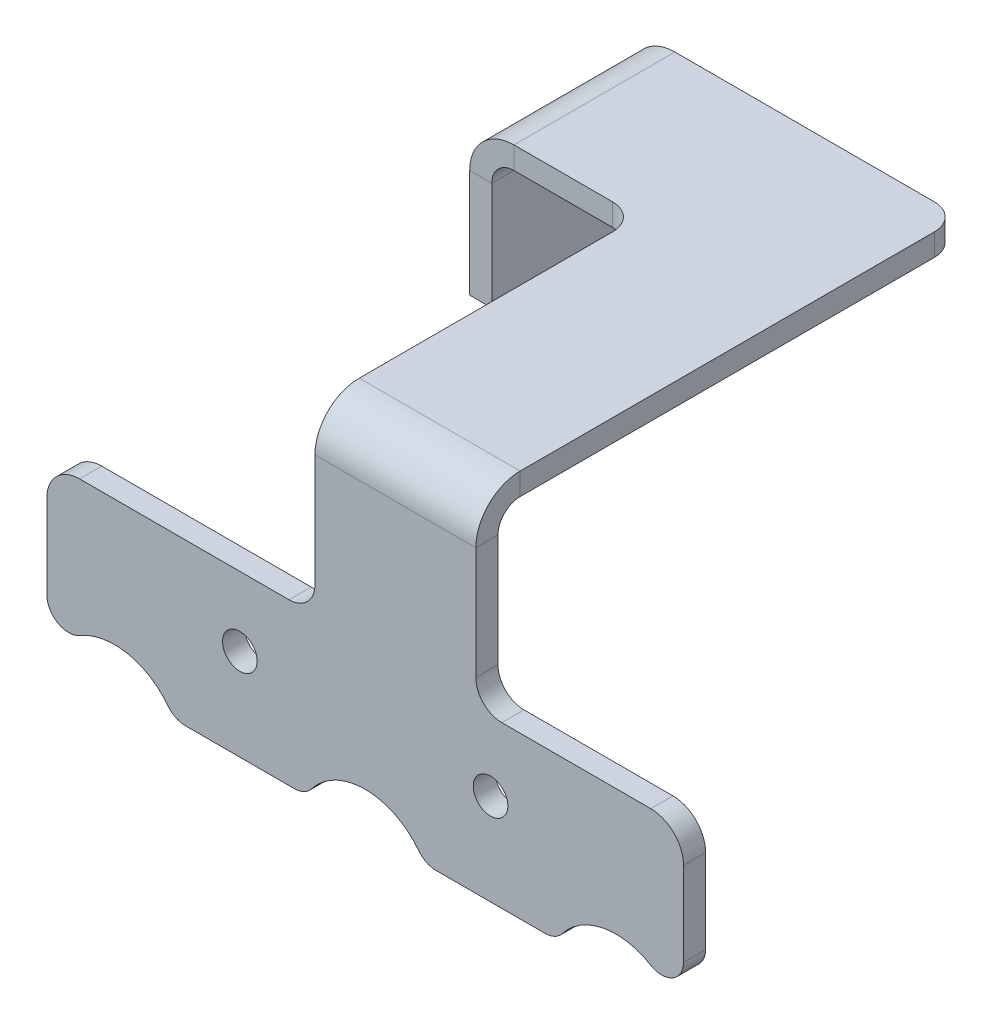
from build123d import *

# Parameters (mm, degrees)
BOSS_EXTRUDE1_DEPTH = 2.032
FILLET1_R           = 3
FILLET2_R           = 2
SKETCH14_R          = 1.5874999999999986
CUT_EXTRUDE1_DEPTH  = 70.16809880796494
SKETCH15_W          = 14.760000000000002
SKETCH15_H          = 12.699999999999996
BOSS_EXTRUDE4_DEPTH = 2.032
EDGE_FLANGE3_DEPTH  = 14.760000000000002
BOSS_EXTRUDE5_DEPTH = 2.032
EDGE_FLANGE4_DEPTH  = 14.760000000000002
FILLET4_R           = 2.38125


# Sheet-metal steps are written as plain solids
with BuildPart() as part:
    # Sketch3 → Boss-Extrude1 (new body)
    with BuildSketch(Plane.XY):
        with BuildLine():
            ThreePointArc((4.574999999999999, 10.775), (9.225864227432316, 16.77834726283189), (16.200863986500366, 13.774999999999732))
            Line((16.20086398650046, 13.774999999999999), (28.34913601349985, 13.774999999999999))
            ThreePointArc((28.349136013499827, 13.775000000000073), (33.77500000000019, 16.974999999999998), (39.20086398650036, 13.77499999999973))
            Line((39.20086398650045, 13.774999999999999), (51.34913601349986, 13.774999999999999))
            ThreePointArc((51.34913601349983, 13.775000000000077), (58.32413577256787, 16.778347262831836), (62.974999999999994, 10.775000000000002))
            Line((62.974999999999994, 10.775), (62.975, 28.534999999999997))
            Line((62.97500000000001, 28.534999999999997), (4.574999999999999, 28.534999999999997))
            Line((4.574999999999999, 28.534999999999997), (4.574999999999999, 10.774999999999999))
        make_face()
    extrude(amount=BOSS_EXTRUDE1_DEPTH)

    # Fillet1
    fillet1_edges = [part.edges().sort_by_distance(p)[0] for p in [
        (4.574999999999999, 28.534999999999997, 1.016),
        (62.97500000000001, 28.534999999999997, 1.016),
    ]]
    fillet(fillet1_edges, radius=FILLET1_R)

    # Fillet2
    fillet2_edges = [part.edges().sort_by_distance(p)[0] for p in [
        (62.974999999999994, 10.775000000000002, 1.016),
    ]]
    fillet(fillet2_edges, radius=FILLET2_R)
    fillet2_2_edges = [part.edges().sort_by_distance(p)[0] for p in [
        (51.349136013499844, 13.775000000000038, 1.016),
    ]]
    fillet(fillet2_2_edges, radius=FILLET2_R)
    fillet2_3_edges = [part.edges().sort_by_distance(p)[0] for p in [
        (39.20086398650041, 13.774999999999864, 1.016),
    ]]
    fillet(fillet2_3_edges, radius=FILLET2_R)
    fillet2_4_edges = [part.edges().sort_by_distance(p)[0] for p in [
        (28.349136013499837, 13.775000000000036, 1.016),
    ]]
    fillet(fillet2_4_edges, radius=FILLET2_R)
    fillet2_5_edges = [part.edges().sort_by_distance(p)[0] for p in [
        (4.574999999999999, 10.774999999999999, 1.016),
    ]]
    fillet(fillet2_5_edges, radius=FILLET2_R)
    fillet2_6_edges = [part.edges().sort_by_distance(p)[0] for p in [
        (16.200863986500412, 13.774999999999865, 1.016),
    ]]
    fillet(fillet2_6_edges, radius=FILLET2_R)

    # Sketch14 → Cut-Extrude1 (cut, through all)
    with BuildSketch(Plane(origin=(0, 0, 0), x_dir=(-1, 0, 0), z_dir=(0, 0, -1))):
        with Locations((-45.275, 22.184999999999995)):
            Circle(SKETCH14_R)
        with Locations((-22.275000000000002, 22.184999999999995)):
            Circle(SKETCH14_R)
    extrude(amount=-CUT_EXTRUDE1_DEPTH, mode=Mode.SUBTRACT)

    # Sketch15 → Boss-Extrude4 (add)
    with BuildSketch(Plane.XY.offset(2.032)):
        with Locations((36.545, 34.88499999999999)):
            Rectangle(SKETCH15_W, SKETCH15_H)
    extrude(amount=-BOSS_EXTRUDE4_DEPTH)

    # Edge-Flange3 section (across the edge) → Edge-Flange3 (add)
    with BuildSketch(Plane(origin=(29.165000000000003, 43.266999999999996, 1.419e-14), x_dir=(0, -1, -3.49e-15), z_dir=(1, 0, 0))):
        with BuildLine():
            Line((-2.032, 2.032000000000007), (-2.032, 42.418000000000006))
            Line((-2.032, 42.418000000000006), (0, 42.418000000000006))
            Line((0, 42.418000000000006), (0, 2.032000000000007))
            ThreePointArc((0, 2.032000000000007), (0.5951590206289381, 0.5951590206289399), (2.032000000000007, 7.11e-15))
            Line((2.032000000000007, 7.11e-15), (2.0320000000000142, -2.031999999999993))
            ThreePointArc((2.0320000000000142, -2.031999999999993), (-0.8416819587421238, -0.8416819587421274), (-2.032, 2.032000000000007))
        make_face()
    extrude(amount=EDGE_FLANGE3_DEPTH)

    # Sketch19 → Boss-Extrude5 (add)
    with BuildSketch(Plane(origin=(0, 45.298999999999985, 1.5561e-13), x_dir=(1, 0, 0), z_dir=(0, 1, 3.44e-15))):
        Polygon((29.165000000000003, 42.41800000000015), (17.735000000000003, 42.41800000000015), (17.73500000000001, 27.658000000000147), (29.165000000000006, 27.658000000000147), align=None)
    extrude(amount=-BOSS_EXTRUDE5_DEPTH)

    # Edge-Flange4 section (across the edge) → Edge-Flange4 (add)
    with BuildSketch(Plane(origin=(15.703000000000005, 43.2670000000001, -27.657999999999998), x_dir=(1, -3.49e-15, -4.7e-16), z_dir=(-4.7e-16, 3.29e-15, -1))):
        with BuildLine():
            Line((-2.032, 2.032000000000007), (-2.032, 11.93800000000001))
            Line((-2.032, 11.93800000000001), (0, 11.93800000000001))
            Line((0, 11.93800000000001), (0, 2.032000000000007))
            ThreePointArc((0, 2.032000000000007), (0.5951590206289381, 0.5951590206289399), (2.032000000000007, 7.11e-15))
            Line((2.032000000000007, 7.11e-15), (2.0320000000000142, -2.031999999999993))
            ThreePointArc((2.0320000000000142, -2.031999999999993), (-0.8416819587421238, -0.8416819587421274), (-2.032, 2.032000000000007))
        make_face()
    extrude(amount=EDGE_FLANGE4_DEPTH)

    # Fillet4
    fillet4_edges = [part.edges().sort_by_distance(p)[0] for p in [
        (29.165000000000006, 44.28300000000008, -27.657999999999994),
        (29.165000000000003, 28.534999999999997, 1.016),
        (43.925000000000004, 28.534999999999997, 1.016),
        (43.925000000000004, 44.28300000000014, -42.41799999999999),
    ]]
    fillet(fillet4_edges, radius=FILLET4_R)


solid = part.part
